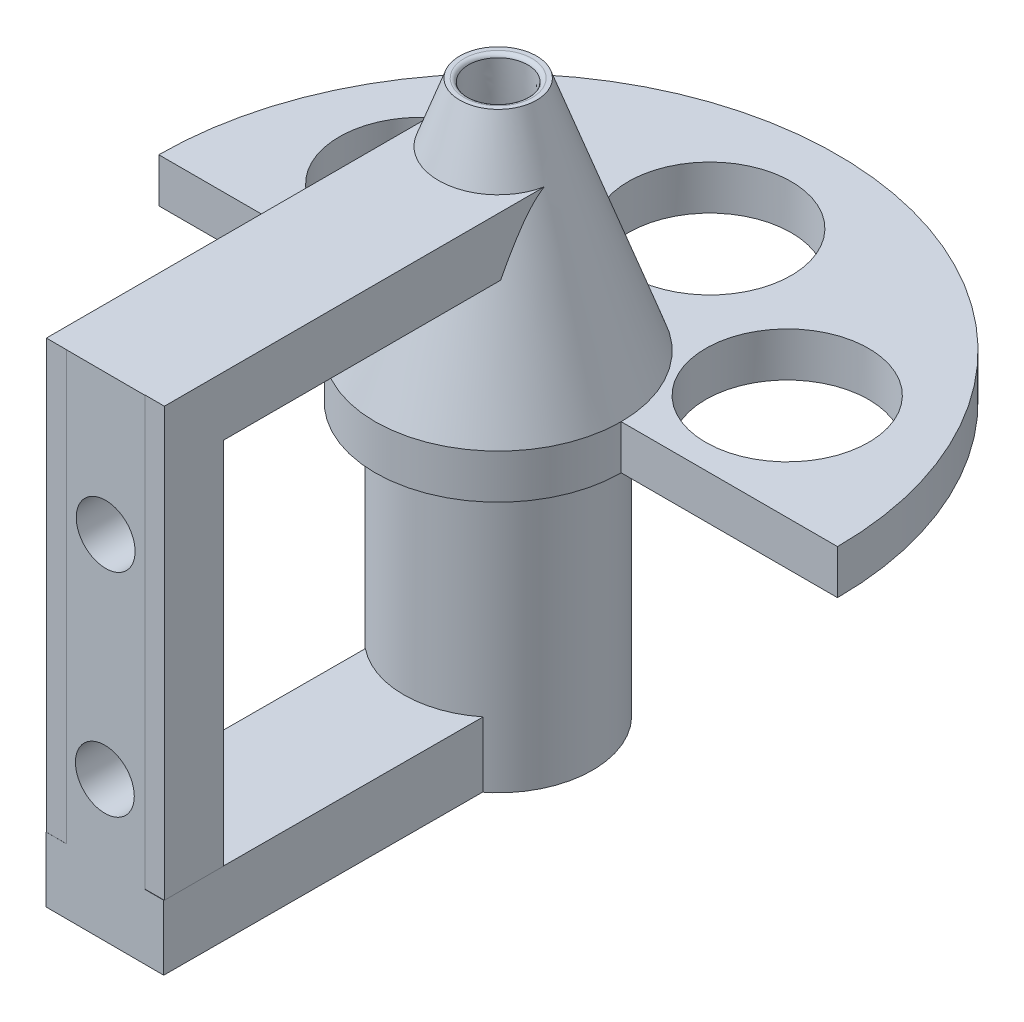
from build123d import *

# Parameters (mm, degrees)
FILLET1_R                 = 0.3
CUT_EXTRUDE1_DEPTH        = 1
CUT_EXTRUDE1_DEPTH_BACK   = 22
SKETCH3_R                 = 3.6
FILLET2_R                 = 0.5
FILLET3_R                 = 0.5
SKETCH11_R                = 5.52
CUT_EXTRUDE3_DEPTH        = 10
CUT_EXTRUDE4_START        = -10
CUT_EXTRUDE4_DEPTH        = 10
BOSS_EXTRUDE1_START       = -3
BOSS_EXTRUDE1_DEPTH       = 3
BOSS_EXTRUDE4_START       = -3
BOSS_EXTRUDE4_DEPTH       = 3
CUT_EXTRUDE5_DEPTH        = 4
SKETCH22_W                = 4
SKETCH22_H                = 3
BOSS_EXTRUDE6_DEPTH       = 15
CUT_EXTRUDE6_START        = 21
SKETCH25_R                = 3.6
CUT_EXTRUDE6_DEPTH        = 21
BOSS_EXTRUDE7_DEPTH       = 3
BOSS_EXTRUDE7_DEPTH_BACK  = 0.5
SKETCH26_W                = 5
SKETCH26_H                = 24
SKETCH27_R                = 1.5
CUT_EXTRUDE8_DEPTH        = 3.5
CUT_EXTRUDE9_DEPTH        = 25
BOSS_EXTRUDE8_DEPTH       = 4
BOSS_EXTRUDE13_DEPTH      = 5.325316
BOSS_EXTRUDE14_DEPTH      = 2
BOSS_EXTRUDE14_DEPTH_BACK = 2
SKETCH44_W                = 5.325340097
SKETCH44_H                = 33.353922233
SKETCH45_W                = 8
SKETCH45_H                = 4.4
BOSS_EXTRUDE15_DEPTH      = 22
SKETCH47_W                = 8
SKETCH47_H                = 4
BOSS_EXTRUDE16_DEPTH      = 29
SKETCH48_W                = 8
SKETCH48_H                = 4
BOSS_EXTRUDE17_DEPTH      = 23
SKETCH52_R                = 2
CUT_EXTRUDE10_DEPTH       = 4.1


with BuildPart() as part:
    # Sketch2 → Revolve1 (revolve)
    with BuildSketch(Plane.XY, mode=Mode.PRIVATE) as revolve1_sk:
        Polygon((2, 0), (2.6, 0), (8.340902118, -16), (20.340902118, -16), (20.340902118, -19), (6.4, -19), (6.4, -37.427752697), (3.4, -37.427752697), (3.4, -16), (2, -16), align=None)
    revolve(revolve1_sk.sketch.rotate(Axis((0, 0, 0), (0, -1, 0)), 90), axis=Axis((0, 0, 0), (0, -1, 0)))

    # Fillet1
    fillet1_edges = [part.edges().sort_by_distance(p)[0] for p in [
        (0, 0, -2),
    ]]
    fillet(fillet1_edges, radius=FILLET1_R)

    # Sketch3 → Cut-Extrude1 (cut, two sides: drawn at the far end of the back side and taken through both)
    with BuildSketch(Plane.XZ.offset(37.427752697).offset(-CUT_EXTRUDE1_DEPTH_BACK)):
        with Locations(Location((0, 0, 0), (0, 0, 270))):
            Circle(SKETCH3_R)
    extrude(amount=CUT_EXTRUDE1_DEPTH + CUT_EXTRUDE1_DEPTH_BACK, mode=Mode.SUBTRACT)

    # Fillet2
    fillet2_edges = [part.edges().sort_by_distance(p)[0] for p in [
        (0, -15.427752697, -2),
    ]]
    fillet(fillet2_edges, radius=FILLET2_R)

    # Fillet3
    fillet3_edges = [part.edges().sort_by_distance(p)[0] for p in [
        (0, -37.427752697, 3.6),
    ]]
    fillet(fillet3_edges, radius=FILLET3_R)

    # Sketch5 → Cut-Loft2 section 0
    with BuildSketch(Plane(origin=(0, -16, 0), x_dir=(1, 0, 0), z_dir=(0, 1, 0))):
        with BuildLine():
            Line((-3.25, -14), (3.25, -14))
            Line((3.25, -14), (3.25, -16))
            Line((3.25, -16), (-3.25, -16))
            Line((-3.25, -16), (-3.25, -14))
        make_face()
    # Sketch6 → Cut-Loft2 section 1
    with BuildSketch(Plane.XZ.offset(19)):
        with BuildLine():
            Line((4.25, 14), (-4.25, 14))
            Line((-4.25, 14), (-4.25, 16))
            Line((-4.25, 16), (4.25, 16))
            Line((4.25, 16), (4.25, 14))
        make_face()
    loft(mode=Mode.SUBTRACT)

    # Sketch8 → Cut-Loft3 section 0
    with BuildSketch(Plane.XZ.offset(19)):
        with BuildLine():
            Line((4.25, 13.5), (-4.25, 13.5))
            Line((-4.25, 13.5), (-4.25, 16.5))
            Line((-4.25, 16.5), (4.25, 16.5))
            Line((4.25, 16.5), (4.25, 13.5))
        make_face()
    # Sketch7 → Cut-Loft3 section 1
    with BuildSketch(Plane(origin=(0, -16, 0), x_dir=(1, 0, 0), z_dir=(0, 1, 0))):
        with BuildLine():
            Line((-3.25, -13.5), (3.25, -13.5))
            Line((3.25, -13.5), (3.25, -16.5))
            Line((3.25, -16.5), (-3.25, -16.5))
            Line((-3.25, -16.5), (-3.25, -13.5))
        make_face()
    loft(mode=Mode.SUBTRACT)

    # Sketch11 → Cut-Extrude3 (cut)
    with BuildSketch(Plane(origin=(0, -16, 0), x_dir=(1, 0, 0), z_dir=(0, 1, 0))):
        with Locations(Location((0, 14.340902118, 0), (0, 0, 270))):
            Circle(SKETCH11_R)
        with Locations(Location((12.419585547, 7.170451059, 0), (0, 0, 270))):
            Circle(SKETCH11_R)
        with BuildLine():
            ThreePointArc((-17.200045776, 9.930451059), (-15.179585547, 2.38999083), (-7.639125318, 4.410451059))
            Line((-7.639125318, 4.410451059), (-12.419585547, 7.170451059))
            Line((-12.419585547, 7.170451059), (-17.200045776, 9.930451059))
        make_face()
        with BuildLine():
            Line((-12.419585547, 7.170451059), (-7.639125318, 4.410451059))
            ThreePointArc((-7.639125318, 4.410451059), (-7.087674986, 5.74176993), (-6.899585547, 7.170451059))
            ThreePointArc((-6.899585547, 7.170451059), (-10.990904418, 12.50236162), (-17.200045776, 9.930451059))
            Line((-17.200045776, 9.930451059), (-12.419585547, 7.170451059))
        make_face()
    extrude(amount=-CUT_EXTRUDE3_DEPTH, mode=Mode.SUBTRACT)

    # Sketch13 → Cut-Extrude4 (cut)
    with BuildSketch(Plane(origin=(0, -16, 0), x_dir=(1, 0, 0), z_dir=(0, 1, 0)).offset(CUT_EXTRUDE4_START)):
        with BuildLine():
            Line((-8.340902118, 0), (-20.340902118, 0))
            ThreePointArc((-20.340902118, 0), (-17.61573797, -10.170451059), (-10.170451059, -17.61573797))
            Line((-10.170451059, -17.61573797), (-4.170451059, -7.223433125))
            ThreePointArc((-4.170451059, -7.223433125), (-7.223433125, -4.170451059), (-8.340902118, 0))
        make_face()
        with BuildLine():
            Line((8.340902118, 0), (20.340902118, 0))
            ThreePointArc((20.340902118, 0), (17.546873261, -10.288806428), (9.932362997, -17.751069384))
            Line((9.932362997, -17.751069384), (4.072821701, -7.278926537))
            ThreePointArc((4.072821701, -7.278926537), (7.195194761, -4.218983349), (8.340902118, 0))
        make_face()
    extrude(amount=CUT_EXTRUDE4_DEPTH, mode=Mode.SUBTRACT)

    # Sketch14 → Boss-Extrude1 (add)
    with BuildSketch(Plane(origin=(0, -16, 0), x_dir=(1, 0, 0), z_dir=(0, 1, 0)).offset(BOSS_EXTRUDE1_START)):
        with BuildLine():
            ThreePointArc((0, 20.340902118), (14.383189823, 14.383189823), (20.340902118, 0))
            Line((20.340902118, 0), (23, 0))
            ThreePointArc((23, 0), (16.263455967, 16.263455967), (0, 23))
            Line((0, 23), (0, 20.340902118))
        make_face()
        with BuildLine():
            Line((-23, 0), (-20.340902118, 0))
            ThreePointArc((-20.340902118, 0), (-14.383189823, 14.383189823), (0, 20.340902118))
            Line((0, 20.340902118), (0, 23))
            ThreePointArc((0, 23), (-16.263455967, 16.263455967), (-23, 0))
        make_face()
    extrude(amount=BOSS_EXTRUDE1_DEPTH)

    # Sketch15 → Boss-Extrude4 (add)
    with BuildSketch(Plane(origin=(0, -16, 0), x_dir=(1, 0, 0), z_dir=(0, 1, 0)).offset(BOSS_EXTRUDE4_START)):
        with BuildLine():
            Line((-10.170451059, -17.61573797), (-8.340902118, 0))
            ThreePointArc((-8.340902118, 0), (0, -8.340902118), (8.340902118, 0))
            Line((8.340902118, 0), (9.932362997, -17.751069384))
            Line((9.932362997, -17.751069384), (0.261097866, -9.671265132))
            Line((0.261097866, -9.671265132), (-10.170451059, -17.61573797))
        make_face()
    extrude(amount=BOSS_EXTRUDE4_DEPTH)

    # Sketch21 → Cut-Extrude5 (cut)
    with BuildSketch(Plane(origin=(0, -16, 0), x_dir=(1, 0, 0), z_dir=(0, 1, 0))):
        with BuildLine():
            Line((8.340902118, 0), (11.037170737, -19.071811198))
            Line((11.037170737, -19.071811198), (-8.909760665, -24.214958869))
            Line((-8.909760665, -24.214958869), (-14.933909552, -10.991923284))
            Line((-14.933909552, -10.991923284), (-8.340902118, 0))
            ThreePointArc((-8.340902118, 0), (0, -8.340902118), (8.340902118, 0))
        make_face()
    extrude(amount=-CUT_EXTRUDE5_DEPTH, mode=Mode.SUBTRACT)

    # Sketch22 → Boss-Extrude6 (add)
    with BuildSketch(Plane.XY):
        with Locations((0, -17.5)):
            Rectangle(SKETCH22_W, SKETCH22_H)
    extrude(amount=BOSS_EXTRUDE6_DEPTH)

    # Sketch25 → Cut-Extrude6 (cut)
    with BuildSketch(Plane.XZ.offset(15.427752697).offset(CUT_EXTRUDE6_START)):
        with Locations(Location((0, 0, 0), (0, 0, 270))):
            Circle(SKETCH25_R)
    extrude(amount=-CUT_EXTRUDE6_DEPTH, mode=Mode.SUBTRACT)

    # Sketch26 → Boss-Extrude7 (add, two sides: drawn at the far end of the back side and taken through both)
    with BuildSketch(Plane.XY.offset(15).offset(-BOSS_EXTRUDE7_DEPTH_BACK)):
        with Locations((0, -28)):
            Rectangle(SKETCH26_W, SKETCH26_H)
    extrude(amount=BOSS_EXTRUDE7_DEPTH + BOSS_EXTRUDE7_DEPTH_BACK)

    # Sketch27 → Cut-Extrude8 (cut)
    with BuildSketch(Plane.XY.offset(18)):
        with Locations((0, -23)):
            Circle(SKETCH27_R)
        with Locations((0, -36)):
            Circle(SKETCH27_R)
    extrude(amount=-CUT_EXTRUDE8_DEPTH, mode=Mode.SUBTRACT)

    # Sketch28 → Cut-Extrude9 (cut)
    with BuildSketch(Plane(origin=(0, -16, 0), x_dir=(1, 0, 0), z_dir=(0, 1, 0))):
        with BuildLine():
            Line((-2, -8.097570509), (-5.786507294, -17.910682883))
            Line((-5.786507294, -17.910682883), (0.518098533, -20.020427682))
            Line((0.518098533, -20.020427682), (6.463906516, -17.731908852))
            Line((6.463906516, -17.731908852), (2, -8.097570509))
            ThreePointArc((2, -8.097570509), (0, -8.340902118), (-2, -8.097570509))
        make_face()
    extrude(amount=-CUT_EXTRUDE9_DEPTH, mode=Mode.SUBTRACT)

    # Sketch32 → Boss-Extrude8 (add)
    with BuildSketch(Plane(origin=(0, -8, 0), x_dir=(1, 0, 0), z_dir=(0, 1, 0))):
        with BuildLine():
            Line((2.65, -4.58993464), (2.65, -24.58993464))
            Line((2.65, -24.58993464), (-2.675318541, -24.575223569))
            Line((-2.675318541, -24.575223569), (-2.675318541, -4.575223569))
            ThreePointArc((-2.675318541, -4.575223569), (-1.400004277, -5.111749996), (-0.029282035, -5.299919109))
            ThreePointArc((-0.029282035, -5.299919109), (1.357593514, -5.123176734), (2.65, -4.58993464))
        make_face()
    extrude(amount=BOSS_EXTRUDE8_DEPTH)

    # Sketch41 → Boss-Extrude13 (add)
    with BuildSketch(Plane(origin=(2.65, 0, 0), x_dir=(0, 0, -1), z_dir=(1, 0, 0))):
        Polygon((-4.785742867, -8), (-6.72871788, -4), (-1.31380645, -4), (-1.671551647, -4.254674229), align=None)
    extrude(amount=-BOSS_EXTRUDE13_DEPTH)

    # Sketch44 → Boss-Extrude14 (add, two sides: drawn at the far end of the back side and taken through both)
    with BuildSketch(Plane(origin=(-0.067908393, 0, 24.58242648), x_dir=(0.9999961843816741, 0, 0.002762466668195937), z_dir=(-0.002762466668195937, 0, 0.9999961843816741)).offset(-BOSS_EXTRUDE14_DEPTH_BACK)):
        with Locations((0.055249952, -20.676961117)):
            Rectangle(SKETCH44_W, SKETCH44_H)
    extrude(amount=BOSS_EXTRUDE14_DEPTH + BOSS_EXTRUDE14_DEPTH_BACK)

    # Sketch45 → Boss-Extrude15 (add)
    with BuildSketch(Plane(origin=(-0.073433326, 0, 26.582418849), x_dir=(0.9999961843816741, 0, 0.002762466668195939), z_dir=(-0.002762466668195939, 0, 0.9999961843816741))):
        with Locations((0, -35.2)):
            Rectangle(SKETCH45_W, SKETCH45_H)
    extrude(amount=-BOSS_EXTRUDE15_DEPTH)

    # Sketch47 → Boss-Extrude16 (add)
    with BuildSketch(Plane(origin=(0, -33, 0), x_dir=(1, 0, 0), z_dir=(0, 1, 0))):
        with Locations((-0.05, -24.57)):
            Rectangle(SKETCH47_W, SKETCH47_H)
    extrude(amount=BOSS_EXTRUDE16_DEPTH)

    # Sketch48 → Boss-Extrude17 (add)
    with BuildSketch(Plane(origin=(0, 0, 22.57), x_dir=(-1, 0, 0), z_dir=(0, 0, -1))):
        with Locations((0.05, -6)):
            Rectangle(SKETCH48_W, SKETCH48_H)
    extrude(amount=BOSS_EXTRUDE17_DEPTH)

    # Cut-Loft5: read off the stored shape, not the designer's step
    # Cut-Loft5: loft between two sections, ruled curve by curve
    cut_loft5_from = [
        Edge.make_bspline([(-2.816606918, -15.427752697, 2.24203601), (1.667465101, -15.427752697, 7.875249846), (7.300678938, -15.427752697, 3.391177826), (2.816606918, -15.427752697, -2.24203601), (-1.667465101, -15.427752697, -7.875249846), (-7.300678938, -15.427752697, -3.391177826), (-2.816606918, -15.427752697, 2.24203601)], [0, 0, 0, 0, 0.5, 0.5, 0.5, 1, 1, 1, 1], 3, [1, 0.333333333, 0.333333333, 1, 0.333333333, 0.333333333, 1]),
    ]
    cut_loft5_to = [
        Edge.make_bspline([(-0.167077254, 0, 1.994679974), (3.822282693, 0, 2.328834482), (4.156437201, 0, -1.660525465), (0.167077254, 0, -1.994679974), (-3.822282693, 0, -2.328834482), (-4.156437201, 0, 1.660525465), (-0.167077254, 0, 1.994679974)], [0, 0, 0, 0, 0.5, 0.5, 0.5, 1, 1, 1, 1], 3, [1, 0.333333333, 0.333333333, 1, 0.333333333, 0.333333333, 1]),
    ]
    cut_loft5 = Solid(Shell([*[Face.make_surface_from_curves(cut_loft5_from[k], cut_loft5_to[k]) for k in range(1)], Face(Wire(cut_loft5_from)), Face(Wire(cut_loft5_to))]))
    add(cut_loft5, mode=Mode.SUBTRACT)

    # Sketch52 → Cut-Extrude10 (cut)
    with BuildSketch(Plane(origin=(-0.073433326, 0, 26.582418849), x_dir=(0.9999961843816741, 0, 0.002762466668195939), z_dir=(-0.002762466668195939, 0, 0.9999961843816741))):
        with Locations((0.055249952, -13.5)):
            Circle(SKETCH52_R)
        with Locations((0, -27.9)):
            Circle(SKETCH52_R)
    extrude(amount=-CUT_EXTRUDE10_DEPTH, mode=Mode.SUBTRACT)


solid = part.part
